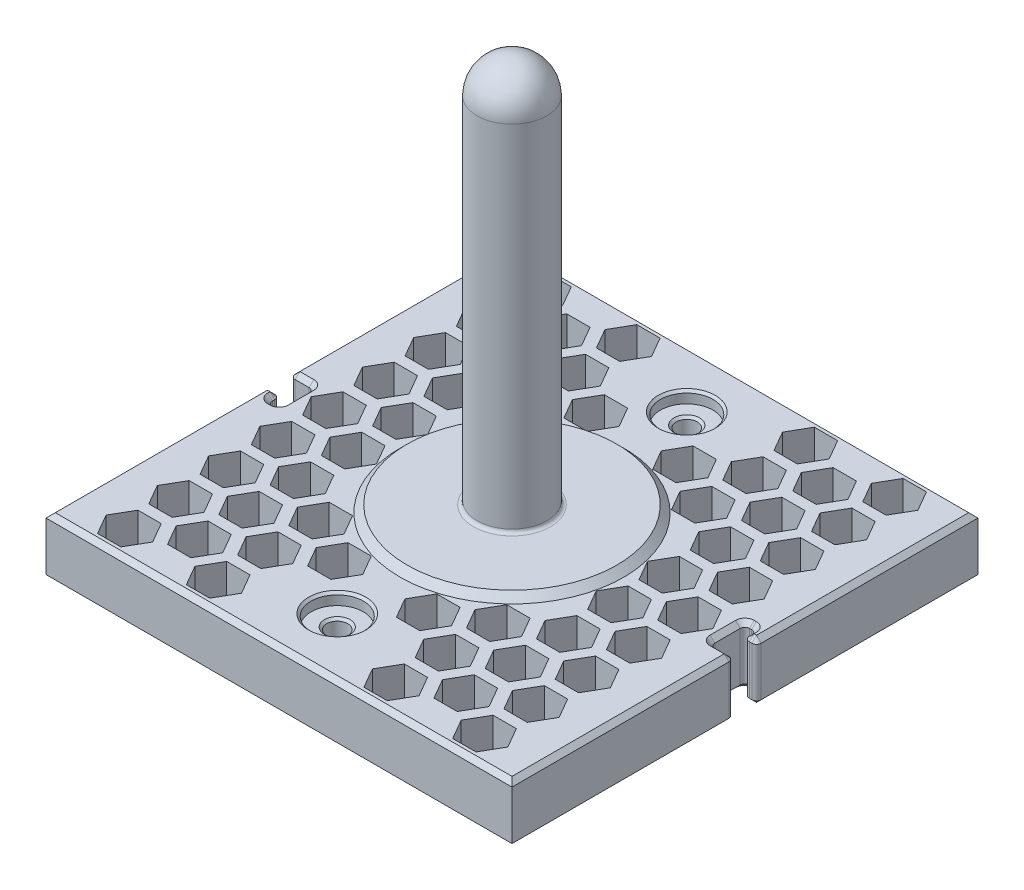
from build123d import *

# Parameters (mm, degrees)
SKETCH1_W           = 200
SKETCH1_H           = 200
BOSS_EXTRUDE1_DEPTH = 25
SKETCH2_R           = 15
BOSS_EXTRUDE2_DEPTH = 170
CUT_EXTRUDE3_REACH  = 242.884
FILLET2_R           = 2
FILLET3_R           = 15
SKETCH4_R           = 45
BOSS_EXTRUDE3_DEPTH = 3
CHAMFER1_SIZE       = 3
FILLET4_R           = 1.5
SKETCH5_R           = 4.5
CUT_EXTRUDE4_DEPTH  = 222.133443875
SKETCH8_R           = 11.25
CUT_EXTRUDE6_DEPTH  = 5
CHAMFER3_SIZE       = 1
FILL_PATTERN1_DEPTH = 25
CHAMFER4_SIZE       = 2


# Read off the part's stored shape, not the designer's step: Fill Pattern1
with BuildPart() as part:
    # Sketch1 → Boss-Extrude1 (new body)
    with BuildSketch(Plane(origin=(0, 0, 0), x_dir=(1, 0, 0), z_dir=(0, 1, 0))):
        Rectangle(SKETCH1_W, SKETCH1_H)
    extrude(amount=BOSS_EXTRUDE1_DEPTH)

    # Sketch2 → Boss-Extrude2 (add)
    with BuildSketch(Plane(origin=(0, 25, 0), x_dir=(1, 0, 0), z_dir=(0, 1, 0))):
        with Locations(Location((0, 0, 0), (0, 0, 270))):
            Circle(SKETCH2_R)
    extrude(amount=BOSS_EXTRUDE2_DEPTH)

    # Sketch3 → Cut-Extrude3 (cut, up to next)
    with BuildSketch(Plane(origin=(0, 0, 0), x_dir=(1, 0, 0), z_dir=(0, 1, 0)), mode=Mode.PRIVATE) as cut_extrude3_sk1:
        with BuildLine():
            Line((-100, 4.95), (-92, 4.95))
            ThreePointArc((-92, 4.95), (-90.585786438, 4.364213562), (-90, 2.95))
            Line((-90, 2.95), (-90, -7.95))
            ThreePointArc((-90, -7.95), (-90.585786438, -9.364213562), (-92, -9.95))
            Line((-92, -9.95), (-92.9, -9.95))
            ThreePointArc((-92.9, -9.95), (-94.314213562, -9.364213562), (-94.9, -7.95))
            Line((-94.9, -7.95), (-94.9, -6.95))
            ThreePointArc((-94.9, -6.95), (-95.485786438, -5.535786438), (-96.9, -4.95))
            Line((-96.9, -4.95), (-100, -4.95))
            Line((-100, -4.95), (-100, 4.95))
        make_face()
    cut_extrude3_tool1 = extrude(cut_extrude3_sk1.sketch, amount=CUT_EXTRUDE3_REACH, mode=Mode.PRIVATE) & part.part
    # Sketch3 → Cut-Extrude3 (cut, up to next)
    with BuildSketch(Plane(origin=(0, 0, 0), x_dir=(1, 0, 0), z_dir=(0, 1, 0)), mode=Mode.PRIVATE) as cut_extrude3_sk2:
        with BuildLine():
            Line((100, -4.95), (92, -4.95))
            ThreePointArc((92, -4.95), (90.585786438, -4.364213562), (90, -2.95))
            Line((90, -2.95), (90, 7.95))
            ThreePointArc((90, 7.95), (90.585786438, 9.364213562), (92, 9.95))
            Line((92, 9.95), (92.9, 9.95))
            ThreePointArc((92.9, 9.95), (94.314213562, 9.364213562), (94.9, 7.95))
            Line((94.9, 7.95), (94.9, 6.95))
            ThreePointArc((94.9, 6.95), (95.485786438, 5.535786438), (96.9, 4.95))
            Line((96.9, 4.95), (100, 4.95))
            Line((100, 4.95), (100, -4.95))
        make_face()
    cut_extrude3_tool2 = extrude(cut_extrude3_sk2.sketch, amount=CUT_EXTRUDE3_REACH, mode=Mode.PRIVATE) & part.part
    add(cut_extrude3_tool1.solids().sort_by_distance((-94.557485, 0, 1.434581))[0], mode=Mode.SUBTRACT)
    add(cut_extrude3_tool2.solids().sort_by_distance((94.557485, 0, -1.434581))[0], mode=Mode.SUBTRACT)

    # Fillet2
    fillet2_edges = [part.edges().sort_by_distance(p)[0] for p in [
        (-100, 12.5, -4.95),
        (-100, 12.5, 4.95),
        (100, 12.5, 4.95),
        (100, 12.5, -4.95),
    ]]
    fillet(fillet2_edges, radius=FILLET2_R)

    # Fillet3
    fillet3_edges = [part.edges().sort_by_distance(p)[0] for p in [
        (0, 195, -15),
    ]]
    fillet(fillet3_edges, radius=FILLET3_R)

    # Sketch4 → Boss-Extrude3 (add)
    with BuildSketch(Plane(origin=(0, 25, 0), x_dir=(1, 0, 0), z_dir=(0, 1, 0))):
        with Locations(Location((0, 0, 0), (0, 0, 270))):
            Circle(SKETCH4_R)
    extrude(amount=BOSS_EXTRUDE3_DEPTH)

    # Chamfer1
    chamfer1_edges = [part.edges().sort_by_distance(p)[0] for p in [
        (0, 25, -45),
    ]]
    chamfer(chamfer1_edges, length=CHAMFER1_SIZE - 0.0001)  # a hair under: the kernel refuses the full size

    # Fillet4
    fillet4_edges = [part.edges().sort_by_distance(p)[0] for p in [
        (0, 28, -15),
    ]]
    fillet(fillet4_edges, radius=FILLET4_R)

    # Sketch5 → Cut-Extrude4 (cut, through all)
    with BuildSketch(Plane(origin=(0, 25, 0), x_dir=(1, 0, 0), z_dir=(0, 1, 0))):
        with Locations(Location((0, 75, 0), (0, 0, 270))):
            Circle(SKETCH5_R)
        with Locations(Location((0, -75, 0), (0, 0, 90))):
            Circle(SKETCH5_R)
    extrude(amount=-CUT_EXTRUDE4_DEPTH, mode=Mode.SUBTRACT)

    # Sketch8 → Cut-Extrude6 (cut)
    with BuildSketch(Plane(origin=(0, 25, 0), x_dir=(1, 0, 0), z_dir=(0, 1, 0))):
        with Locations(Location((0, 75, 0), (0, 0, 270))):
            Circle(SKETCH8_R)
        with Locations(Location((0, -75, 0), (0, 0, 90))):
            Circle(SKETCH8_R)
    extrude(amount=-CUT_EXTRUDE6_DEPTH, mode=Mode.SUBTRACT)

    # Chamfer3
    chamfer3_edges = [part.edges().sort_by_distance(p)[0] for p in [
        (0, 25, -86.25),
        (0, 20, -79.5),
        (0, 20, 79.5),
        (0, 25, 86.25),
    ]]
    chamfer(chamfer3_edges, length=CHAMFER3_SIZE)

    # Fill Pattern1 outline → Fill Pattern1 (cut)
    with BuildSketch(Plane(origin=(0, 0, 0), x_dir=(1, 0, 0), z_dir=(0, 1, 0))):
        Polygon((-86.210235533, 88), (-81.210235533, 79.339745962), (-71.210235533, 79.339745962), (-66.210235533, 88), (-71.210235533, 96.660254038), (-81.210235533, 96.660254038), align=None)
        Polygon((-67.15767665, 55), (-62.15767665, 46.339745962), (-52.15767665, 46.339745962), (-47.15767665, 55), (-52.15767665, 63.660254038), (-62.15767665, 63.660254038), align=None)
        Polygon((-43.105117767, 79.339745962), (-33.105117767, 79.339745962), (-28.105117767, 88), (-33.105117767, 96.660254038), (-43.105117767, 96.660254038), (-48.105117767, 88), align=None)
        Polygon((33.105117767, 79.339745962), (43.105117767, 79.339745962), (48.105117767, 88), (43.105117767, 96.660254038), (33.105117767, 96.660254038), (28.105117767, 88), align=None)
        Polygon((71.210235533, 79.339745962), (81.210235533, 79.339745962), (86.210235533, 88), (81.210235533, 96.660254038), (71.210235533, 96.660254038), (66.210235533, 88), align=None)
        Polygon((-86.210235533, -22), (-81.210235533, -30.660254038), (-71.210235533, -30.660254038), (-66.210235533, -22), (-71.210235533, -13.339745962), (-81.210235533, -13.339745962), align=None)
        Polygon((-48.105117767, -88), (-43.105117767, -96.660254038), (-33.105117767, -96.660254038), (-28.105117767, -88), (-33.105117767, -79.339745962), (-43.105117767, -79.339745962), align=None)
        Polygon((-67.15767665, -55), (-62.15767665, -63.660254038), (-52.15767665, -63.660254038), (-47.15767665, -55), (-52.15767665, -46.339745962), (-62.15767665, -46.339745962), align=None)
        Polygon((71.210235533, -30.660254038), (81.210235533, -30.660254038), (86.210235533, -22), (81.210235533, -13.339745962), (71.210235533, -13.339745962), (66.210235533, -22), align=None)
        Polygon((-52.15767665, 2.339745962), (-47.15767665, 11), (-52.15767665, 19.660254038), (-62.15767665, 19.660254038), (-67.15767665, 11), (-62.15767665, 2.339745962), align=None)
        Polygon((-33.105117767, 35.339745962), (-28.105117767, 44), (-33.105117767, 52.660254038), (-43.105117767, 52.660254038), (-48.105117767, 44), (-43.105117767, 35.339745962), align=None)
        Polygon((-29.052558883, -55), (-24.052558883, -63.660254038), (-14.052558883, -63.660254038), (-9.052558883, -55), (-14.052558883, -46.339745962), (-24.052558883, -46.339745962), align=None)
        Polygon((-86.210235533, 44), (-81.210235533, 35.339745962), (-71.210235533, 35.339745962), (-66.210235533, 44), (-71.210235533, 52.660254038), (-81.210235533, 52.660254038), align=None)
        Polygon((52.15767665, 2.339745962), (62.15767665, 2.339745962), (67.15767665, 11), (62.15767665, 19.660254038), (52.15767665, 19.660254038), (47.15767665, 11), align=None)
        Polygon((-86.210235533, 22), (-81.210235533, 13.339745962), (-71.210235533, 13.339745962), (-66.210235533, 22), (-71.210235533, 30.660254038), (-81.210235533, 30.660254038), align=None)
        Polygon((-67.15767665, -11), (-62.15767665, -19.660254038), (-52.15767665, -19.660254038), (-47.15767665, -11), (-52.15767665, -2.339745962), (-62.15767665, -2.339745962), align=None)
        Polygon((-48.105117767, -44), (-43.105117767, -52.660254038), (-33.105117767, -52.660254038), (-28.105117767, -44), (-33.105117767, -35.339745962), (-43.105117767, -35.339745962), align=None)
        Polygon((71.210235533, 13.339745962), (81.210235533, 13.339745962), (86.210235533, 22), (81.210235533, 30.660254038), (71.210235533, 30.660254038), (66.210235533, 22), align=None)
        Polygon((9.052558883, -55), (14.052558883, -63.660254038), (24.052558883, -63.660254038), (29.052558883, -55), (24.052558883, -46.339745962), (14.052558883, -46.339745962), align=None)
        Polygon((28.105117767, -88), (33.105117767, -96.660254038), (43.105117767, -96.660254038), (48.105117767, -88), (43.105117767, -79.339745962), (33.105117767, -79.339745962), align=None)
        Polygon((-67.15767665, 77), (-62.15767665, 68.339745962), (-52.15767665, 68.339745962), (-47.15767665, 77), (-52.15767665, 85.660254038), (-62.15767665, 85.660254038), align=None)
        Polygon((52.15767665, -63.660254038), (62.15767665, -63.660254038), (67.15767665, -55), (62.15767665, -46.339745962), (52.15767665, -46.339745962), (47.15767665, -55), align=None)
        Polygon((81.210235533, 35.339745962), (86.210235533, 44), (81.210235533, 52.660254038), (71.210235533, 52.660254038), (66.210235533, 44), (71.210235533, 35.339745962), align=None)
        Polygon((-86.210235533, 0), (-81.210235533, -8.660254038), (-71.210235533, -8.660254038), (-66.210235533, 0), (-71.210235533, 8.660254038), (-81.210235533, 8.660254038), align=None)
        Polygon((-48.105117767, -66), (-43.105117767, -74.660254038), (-33.105117767, -74.660254038), (-28.105117767, -66), (-33.105117767, -57.339745962), (-43.105117767, -57.339745962), align=None)
        Polygon((-67.15767665, -33), (-62.15767665, -41.660254038), (-52.15767665, -41.660254038), (-47.15767665, -33), (-52.15767665, -24.339745962), (-62.15767665, -24.339745962), align=None)
        Polygon((71.210235533, -8.660254038), (81.210235533, -8.660254038), (86.210235533, 0), (81.210235533, 8.660254038), (71.210235533, 8.660254038), (66.210235533, 0), align=None)
        Polygon((-52.15767665, 24.339745962), (-47.15767665, 33), (-52.15767665, 41.660254038), (-62.15767665, 41.660254038), (-67.15767665, 33), (-62.15767665, 24.339745962), align=None)
        Polygon((-33.105117767, 57.339745962), (-28.105117767, 66), (-33.105117767, 74.660254038), (-43.105117767, 74.660254038), (-48.105117767, 66), (-43.105117767, 57.339745962), align=None)
        Polygon((-81.210235533, -96.660254038), (-71.210235533, -96.660254038), (-66.210235533, -88), (-71.210235533, -79.339745962), (-81.210235533, -79.339745962), (-86.210235533, -88), align=None)
        Polygon((71.210235533, -96.660254038), (81.210235533, -96.660254038), (86.210235533, -88), (81.210235533, -79.339745962), (71.210235533, -79.339745962), (66.210235533, -88), align=None)
        Polygon((62.15767665, 68.339745962), (67.15767665, 77), (62.15767665, 85.660254038), (52.15767665, 85.660254038), (47.15767665, 77), (52.15767665, 68.339745962), align=None)
        Polygon((43.105117767, 35.339745962), (48.105117767, 44), (43.105117767, 52.660254038), (33.105117767, 52.660254038), (28.105117767, 44), (33.105117767, 35.339745962), align=None)
        Polygon((-86.210235533, -66), (-81.210235533, -74.660254038), (-71.210235533, -74.660254038), (-66.210235533, -66), (-71.210235533, -57.339745962), (-81.210235533, -57.339745962), align=None)
        Polygon((33.105117767, -74.660254038), (43.105117767, -74.660254038), (48.105117767, -66), (43.105117767, -57.339745962), (33.105117767, -57.339745962), (28.105117767, -66), align=None)
        Polygon((71.210235533, -74.660254038), (81.210235533, -74.660254038), (86.210235533, -66), (81.210235533, -57.339745962), (71.210235533, -57.339745962), (66.210235533, -66), align=None)
        Polygon((-67.15767665, -77), (-62.15767665, -85.660254038), (-52.15767665, -85.660254038), (-47.15767665, -77), (-52.15767665, -68.339745962), (-62.15767665, -68.339745962), align=None)
        Polygon((-86.210235533, -44), (-81.210235533, -52.660254038), (-71.210235533, -52.660254038), (-66.210235533, -44), (-71.210235533, -35.339745962), (-81.210235533, -35.339745962), align=None)
        Polygon((52.15767665, -85.660254038), (62.15767665, -85.660254038), (67.15767665, -77), (62.15767665, -68.339745962), (52.15767665, -68.339745962), (47.15767665, -77), align=None)
        Polygon((24.052558883, 46.339745962), (29.052558883, 55), (24.052558883, 63.660254038), (14.052558883, 63.660254038), (9.052558883, 55), (14.052558883, 46.339745962), align=None)
        Polygon((62.15767665, -41.660254038), (67.15767665, -33), (62.15767665, -24.339745962), (52.15767665, -24.339745962), (47.15767665, -33), (52.15767665, -41.660254038), align=None)
        Polygon((-86.210235533, 66), (-81.210235533, 57.339745962), (-71.210235533, 57.339745962), (-66.210235533, 66), (-71.210235533, 74.660254038), (-81.210235533, 74.660254038), align=None)
        Polygon((52.15767665, 24.339745962), (62.15767665, 24.339745962), (67.15767665, 33), (62.15767665, 41.660254038), (52.15767665, 41.660254038), (47.15767665, 33), align=None)
        Polygon((66.210235533, -44), (71.210235533, -52.660254038), (81.210235533, -52.660254038), (86.210235533, -44), (81.210235533, -35.339745962), (71.210235533, -35.339745962), align=None)
        Polygon((47.15767665, -11), (52.15767665, -19.660254038), (62.15767665, -19.660254038), (67.15767665, -11), (62.15767665, -2.339745962), (52.15767665, -2.339745962), align=None)
        Polygon((-24.052558883, 46.339745962), (-14.052558883, 46.339745962), (-9.052558883, 55), (-14.052558883, 63.660254038), (-24.052558883, 63.660254038), (-29.052558883, 55), align=None)
        Polygon((52.15767665, 46.339745962), (62.15767665, 46.339745962), (67.15767665, 55), (62.15767665, 63.660254038), (52.15767665, 63.660254038), (47.15767665, 55), align=None)
        Polygon((43.105117767, 57.339745962), (48.105117767, 66), (43.105117767, 74.660254038), (33.105117767, 74.660254038), (28.105117767, 66), (33.105117767, 57.339745962), align=None)
        Polygon((33.105117767, -52.660254038), (43.105117767, -52.660254038), (48.105117767, -44), (43.105117767, -35.339745962), (33.105117767, -35.339745962), (28.105117767, -44), align=None)
        Polygon((71.210235533, 57.339745962), (81.210235533, 57.339745962), (86.210235533, 66), (81.210235533, 74.660254038), (71.210235533, 74.660254038), (66.210235533, 66), align=None)
    extrude(amount=FILL_PATTERN1_DEPTH, mode=Mode.SUBTRACT)

    # Chamfer4
    chamfer4_edges = [part.edges().sort_by_distance(p)[0] for p in [
        (-100, 25, -53.475),
        (0, 25, 100),
        (-95.485786438, 0, 5.535786438),
        (-94.9, 0, 7.45),
        (-94.314213562, 0, 9.364213562),
        (-92.45, 0, 9.95),
        (-90.585786438, 0, 9.364213562),
        (-90, 0, 2.5),
        (-90.585786438, 0, -4.364213562),
        (-95, 0, -4.95),
        (-95.485786438, 25, 5.535786438),
        (-94.9, 25, 7.45),
        (-94.314213562, 25, 9.364213562),
        (-92.45, 25, 9.95),
        (-90.585786438, 25, 9.364213562),
        (-90, 25, 2.5),
        (-90.585786438, 25, -4.364213562),
        (-95, 25, -4.95),
        (95.485786438, 0, -5.535786438),
        (100, 25, 53.475),
        (0, 0, 100),
        (94.9, 0, -7.45),
        (94.314213562, 0, -9.364213562),
        (92.45, 0, -9.95),
        (90.585786438, 0, -9.364213562),
        (90, 0, -2.5),
        (90.585786438, 0, 4.364213562),
        (95, 0, 4.95),
        (95.485786438, 25, -5.535786438),
        (94.9, 25, -7.45),
        (94.314213562, 25, -9.364213562),
        (92.45, 25, -9.95),
        (90.585786438, 25, -9.364213562),
        (90, 25, -2.5),
        (90.585786438, 25, 4.364213562),
        (95, 25, 4.95),
        (-100, 0, -53.475),
        (0, 0, -100),
        (100, 0, 53.475),
        (-97.45, 0, 4.95),
        (100, 0, -53.475),
        (97.45, 0, -4.95),
        (-100, 0, 53.475),
        (-99.414213562, 0, -5.535786438),
        (-99.414213562, 0, 5.535786438),
        (99.414213562, 0, -5.535786438),
        (99.414213562, 0, 5.535786438),
        (-97.45, 25, 4.95),
        (-100, 25, 53.475),
        (97.45, 25, -4.95),
        (100, 25, -53.475),
        (-99.414213562, 25, -5.535786438),
        (-99.414213562, 25, 5.535786438),
        (99.414213562, 25, -5.535786438),
        (99.414213562, 25, 5.535786438),
        (0, 25, -100),
    ]]
    chamfer(chamfer4_edges, length=CHAMFER4_SIZE - 0.0001)  # a hair under: the kernel refuses the full size


solid = part.part
